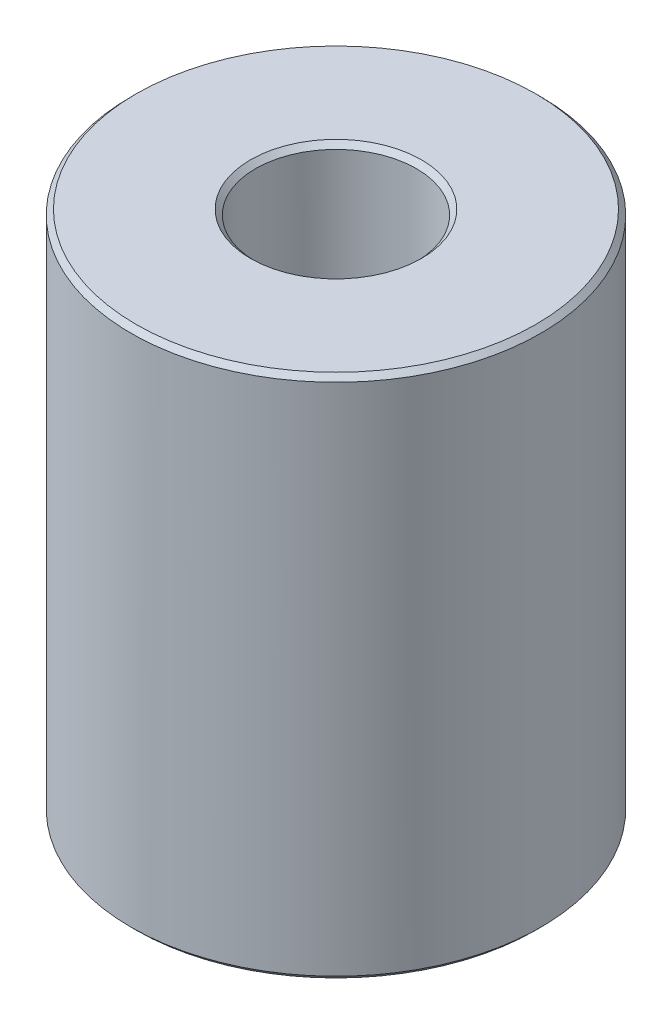
from build123d import *

# Parameters (mm, degrees)
SKETCH1_R           = 57.5
BOSS_EXTRUDE1_DEPTH = 147.217348148
SKETCH2_R           = 22.567468833
CUT_EXTRUDE1_DEPTH  = 169.182780319
CHAMFER1_SIZE       = 1.43097936


with BuildPart() as part:
    # Sketch1 → Boss-Extrude1 (new body)
    with BuildSketch(Plane(origin=(0, 0, 0), x_dir=(1, 0, 0), z_dir=(0, 1, 0))):
        Circle(SKETCH1_R)
    extrude(amount=BOSS_EXTRUDE1_DEPTH)

    # Sketch2 → Cut-Extrude1 (cut, through all)
    with BuildSketch(Plane(origin=(0, 0, 0), x_dir=(1, 0, 0), z_dir=(0, 1, 0))):
        Circle(SKETCH2_R)
    extrude(amount=CUT_EXTRUDE1_DEPTH, mode=Mode.SUBTRACT)

    # Chamfer1
    chamfer1_edges = [part.edges().sort_by_distance(p)[0] for p in [
        (-22.567468833, 147.217348148, 0),
        (-22.567468833, 0, 0),
        (-57.5, 0, 0),
        (-57.5, 147.217348148, 0),
    ]]
    chamfer(chamfer1_edges, length=CHAMFER1_SIZE)


solid = part.part
